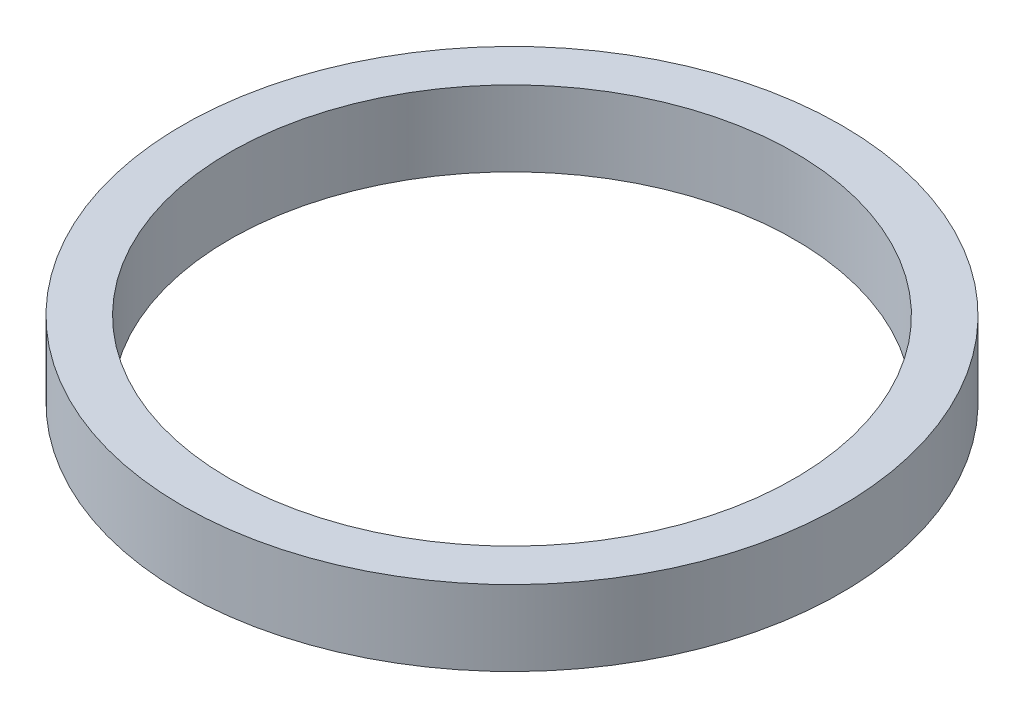
from build123d import *

# Parameters (mm, degrees)
SKETCH1_R           = 52.5
BOSS_EXTRUDE1_DEPTH = 12
SKETCH2_R           = 45
CUT_EXTRUDE1_DEPTH  = 76.20970682


with BuildPart() as part:
    # Sketch1 → Boss-Extrude1 (new body)
    with BuildSketch(Plane(origin=(0, 0, 0), x_dir=(1, 0, 0), z_dir=(0, 1, 0))):
        Circle(SKETCH1_R)
    extrude(amount=BOSS_EXTRUDE1_DEPTH)

    # Sketch2 → Cut-Extrude1 (cut, through all)
    with BuildSketch(Plane(origin=(0, 0, 0), x_dir=(1, 0, 0), z_dir=(0, 1, 0))):
        Circle(SKETCH2_R)
    extrude(amount=CUT_EXTRUDE1_DEPTH, mode=Mode.SUBTRACT)


solid = part.part
